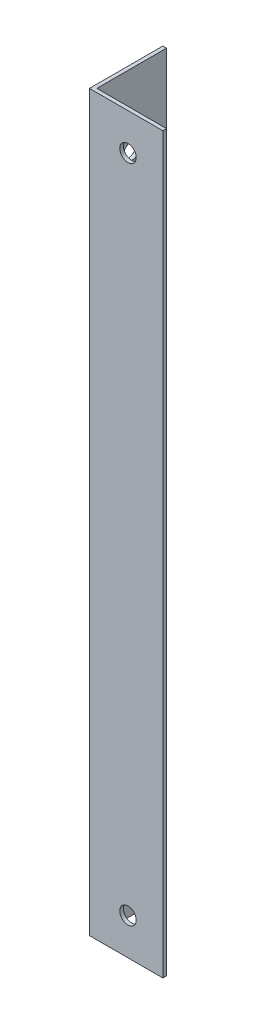
from build123d import *

# Parameters (mm, degrees)
EXTRUDE_1_DEPTH     = 200
SKETCH_2_R          = 2.25
CUT_EXTRUDE_1_DEPTH = 202.893536301
SKETCH_3_R          = 2.25
CUT_EXTRUDE_2_DEPTH = 202.893536301
SKETCH_4_R          = 2.25
CUT_EXTRUDE_3_DEPTH = 202.893536301
SKETCH_5_R          = 2.25
CUT_EXTRUDE_4_DEPTH = 202.893536301


with BuildPart() as part:
    # Эскиз1 → Бобышка-Вытянуть1 (new body)
    with BuildSketch(Plane(origin=(0, 0, 0), x_dir=(1, 0, 0), z_dir=(0, 1, 0))):
        Polygon((0, 0), (0, 20), (1, 20), (1, 1), (20, 1), (20, 0), align=None)
    extrude(amount=EXTRUDE_1_DEPTH)

    # Эскиз2 → Вырез-Вытянуть1 (cut, through all)
    with BuildSketch(Plane(origin=(1, 0, 0), x_dir=(0, 0, -1), z_dir=(1, 0, 0))):
        with Locations((10.5, 29.5)):
            Circle(SKETCH_2_R)
    extrude(amount=-CUT_EXTRUDE_1_DEPTH, mode=Mode.SUBTRACT)

    # Эскиз3 → Вырез-Вытянуть2 (cut, through all)
    with BuildSketch(Plane(origin=(0, 0, -1), x_dir=(-1, 0, 0), z_dir=(0, 0, -1))):
        with Locations((-10.5, 10)):
            Circle(SKETCH_3_R)
    extrude(amount=-CUT_EXTRUDE_2_DEPTH, mode=Mode.SUBTRACT)

    # Эскиз4 → Вырез-Вытянуть3 (cut, through all)
    with BuildSketch(Plane(origin=(0, 0, -1), x_dir=(-1, 0, 0), z_dir=(0, 0, -1))):
        with Locations((-10.5, 190)):
            Circle(SKETCH_4_R)
    extrude(amount=-CUT_EXTRUDE_3_DEPTH, mode=Mode.SUBTRACT)

    # Эскиз5 → Вырез-Вытянуть4 (cut, through all)
    with BuildSketch(Plane(origin=(1, 0, 0), x_dir=(0, 0, -1), z_dir=(1, 0, 0))):
        with Locations((10.5, 180.5)):
            Circle(SKETCH_5_R)
    extrude(amount=-CUT_EXTRUDE_4_DEPTH, mode=Mode.SUBTRACT)


solid = part.part
